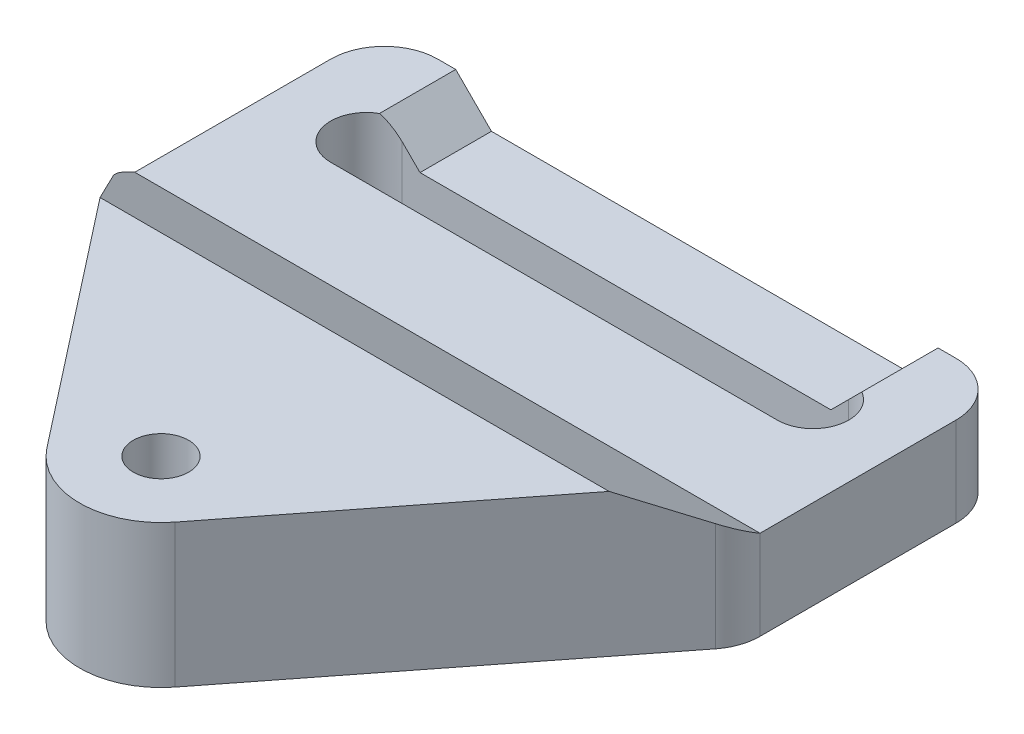
from build123d import *

# Parameters (mm, degrees)
SKETCH1_R           = 1.55
BOSS_EXTRUDE1_DEPTH = 5
SKETCH2_W           = 29
SKETCH2_H           = 6
CUT_EXTRUDE1_DEPTH  = 2
CHAMFER1_START      = 3
CHAMFER1_DEPTH      = 2
CHAMFER1_START_2    = -30
CHAMFER1_2_DEPTH    = 6
FILLET1_R           = 3
SKETCH3_R           = 1.55
BOSS_EXTRUDE2_DEPTH = 3
CHAMFER2_SIZE2      = 5.196152423
CHAMFER2_SIZE       = 3


with BuildPart() as part:
    # Sketch1 → Boss-Extrude1 (new body)
    with BuildSketch(Plane(origin=(0, 0, 0), x_dir=(1, 0, 0), z_dir=(0, 1, 0))):
        with BuildLine():
            Line((-3.584795955, -2.802095281), (-17.5, 15))
            Line((-17.5, 15), (-17.5, 27))
            ThreePointArc((-17.5, 27), (-16.621320344, 29.121320344), (-14.5, 30))
            Line((-14.5, 30), (14.5, 30))
            ThreePointArc((14.5, 30), (16.621320344, 29.121320344), (17.5, 27))
            Line((17.5, 27), (17.5, 15))
            Line((17.5, 15), (3.584795955, -2.802095281))
            ThreePointArc((3.584795955, -2.802095281), (0, -4.55), (-3.584795955, -2.802095281))
        make_face()
        with Locations(Location((0, 0, 0), (0, 0, 270))):
            Circle(SKETCH1_R, mode=Mode.SUBTRACT)
        with BuildLine():
            Line((12.5, 22), (-12.5, 22))
            ThreePointArc((-12.5, 22), (-14.5, 24), (-12.5, 26))
            Line((-12.5, 26), (12.5, 26))
            ThreePointArc((12.5, 26), (14.5, 24), (12.5, 22))
        make_face(mode=Mode.SUBTRACT)
    extrude(amount=BOSS_EXTRUDE1_DEPTH)

    # Sketch2 → Cut-Extrude1 (cut)
    with BuildSketch(Plane(origin=(0, 5, 0), x_dir=(1, 0, 0), z_dir=(0, 1, 0))):
        with Locations((0, 27)):
            Rectangle(SKETCH2_W, SKETCH2_H)
    extrude(amount=-CUT_EXTRUDE1_DEPTH, mode=Mode.SUBTRACT)

    # Chamfer1: read off the stored shape, not the designer's step
    # Chamfer1 outline → Chamfer1 (add)
    with BuildSketch(Plane(origin=(0, 0, 0), x_dir=(1, 0, 0), z_dir=(0, 1, 0)).offset(CHAMFER1_START)):
        with BuildLine():
            Line((-12.5, 26), (12.5, 26))
            ThreePointArc((12.5, 26), (13.914213562, 25.414213562), (14.5, 24))
            Line((14.5, 24), (14.5, 30))
            Line((14.5, 30), (-14.5, 30))
            Line((-14.5, 30), (-14.5, 24))
            ThreePointArc((-14.5, 24), (-13.914213562, 25.414213562), (-12.5, 26))
        make_face()
    extrude(amount=CHAMFER1_DEPTH)

    # Chamfer1 2 outline → Chamfer1 2 (cut)
    with BuildSketch(Plane.XY.offset(CHAMFER1_START_2)):
        Polygon((-13.5, 5), (-11.5, 3), (11.5, 3), (13.5, 5), align=None)
    extrude(amount=CHAMFER1_2_DEPTH, mode=Mode.SUBTRACT)

    # Fillet1
    fillet1_edges = [part.edges().sort_by_distance(p)[0] for p in [
        (-17.5, 2.5, -15),
        (17.5, 2.5, -15),
    ]]
    fillet(fillet1_edges, radius=FILLET1_R)

    # Sketch3 → Boss-Extrude2 (add)
    with BuildSketch(Plane(origin=(0, 5, 0), x_dir=(1, 0, 0), z_dir=(0, 1, 0))):
        with BuildLine():
            Line((-17.5, 16.033373903), (17.5, 16.033373903))
            ThreePointArc((17.5, 16.033373903), (17.33644189, 15.056338894), (16.863601728, 14.185838553))
            Line((16.863601728, 14.185838553), (3.584795955, -2.802095281))
            ThreePointArc((3.584795955, -2.802095281), (0, -4.55), (-3.584795955, -2.802095281))
            Line((-3.584795955, -2.802095281), (-16.863601728, 14.185838553))
            ThreePointArc((-16.863601728, 14.185838553), (-17.33644189, 15.056338894), (-17.5, 16.033373903))
        make_face()
        with Locations(Location((0, 0, 0), (0, 0, 270))):
            Circle(SKETCH3_R, mode=Mode.SUBTRACT)
    extrude(amount=BOSS_EXTRUDE2_DEPTH)

    # Chamfer2
    chamfer2_edges = [part.edges().sort_by_distance(p)[0] for p in [
        (0, 8, -16.033373903),
    ]]
    chamfer2_side = [part.faces().sort_by_distance(p)[0] for p in [
        (0, 7.94, -16.033373903),
    ]]
    chamfer(chamfer2_edges, length=CHAMFER2_SIZE - 0.0001, length2=CHAMFER2_SIZE2 - 0.0001, reference=chamfer2_side[0])  # a hair under: the kernel refuses the full size


solid = part.part
